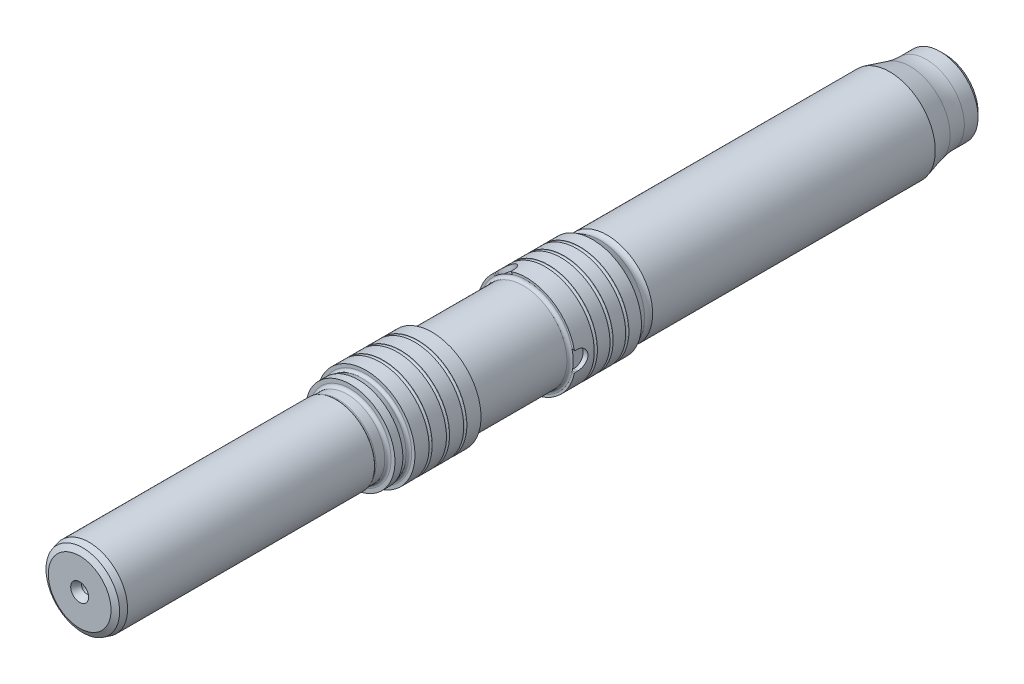
from build123d import *

# Parameters (mm, degrees)
CUT_EXTRUDE1_DEPTH = 1.55
CIRPATTERN1_COUNT  = 3


with BuildPart() as part:
    # Sketch1 → Revolve1 (revolve)
    with BuildSketch(Plane(origin=(0, 0, 0), x_dir=(0, 0, -1), z_dir=(1, 0, 0))):
        with BuildLine():
            Line((-17.5, 14.4875), (-107.351574436, 14.4875))
            ThreePointArc((-107.351574436, 14.4875), (-108.480333208, 13.985861828), (-109.688490196, 14.242949192))
            Line((-109.688490196, 14.242949192), (-112, 15.5775))
            Line((-112, 15.5775), (-116, 15.5775))
            Line((-116, 15.5775), (-116, 15.45))
            ThreePointArc((-116, 15.45), (-116.5, 14.95), (-117, 15.45))
            Line((-117, 15.45), (-117, 15.5775))
            Line((-117, 15.5775), (-121, 15.5775))
            Line((-121, 15.5775), (-121, 15.45))
            ThreePointArc((-121, 15.45), (-121.5, 14.95), (-122, 15.45))
            Line((-122, 15.45), (-122, 15.5775))
            Line((-122, 15.5775), (-126, 15.5775))
            Line((-126, 15.5775), (-126, 15.45))
            ThreePointArc((-126, 15.45), (-126.5, 14.95), (-127, 15.45))
            Line((-127, 15.45), (-127, 15.5775))
            Line((-127, 15.5775), (-133, 15.5775))
            Line((-133, 15.5775), (-133, 14.875))
            ThreePointArc((-133, 14.875), (-133.292893219, 14.167893219), (-134, 13.875))
            Line((-134, 13.875), (-162, 13.875))
            ThreePointArc((-162, 13.875), (-162.707106781, 14.167893219), (-163, 14.875))
            Line((-163, 14.875), (-163, 15.5775))
            Line((-163, 15.5775), (-167.5, 15.5775))
            Line((-167.5, 15.5775), (-167.5, 15.45))
            ThreePointArc((-167.5, 15.45), (-168, 14.95), (-168.5, 15.45))
            Line((-168.5, 15.45), (-168.5, 15.5775))
            Line((-168.5, 15.5775), (-173, 15.5775))
            Line((-173, 15.5775), (-173, 15.45))
            ThreePointArc((-173, 15.45), (-173.5, 14.95), (-174, 15.45))
            Line((-174, 15.45), (-174, 15.5775))
            Line((-174, 15.5775), (-178.5, 15.5775))
            Line((-178.5, 15.5775), (-178.5, 15.45))
            ThreePointArc((-178.5, 15.45), (-179, 14.95), (-179.5, 15.45))
            Line((-179.5, 15.45), (-179.5, 15.5775))
            Line((-179.5, 15.5775), (-184, 15.5775))
            Line((-184, 15.5775), (-184, 14.55))
            ThreePointArc((-184, 14.55), (-184.324003635, 13.907016749), (-185.033568652, 13.784855775))
            Line((-185.033568652, 13.784855775), (-186.5, 14.2325))
            Line((-186.5, 14.2325), (-189, 14.2325))
            Line((-189, 14.2325), (-189, 12.9925))
            ThreePointArc((-189, 12.9925), (-189.292893219, 12.285393219), (-190, 11.9925))
            Line((-190, 11.9925), (-192.84427521, 11.9925))
            ThreePointArc((-192.84427521, 11.9925), (-193.19427521, 12.0557503), (-193.5, 12.2375))
            Line((-193.5, 12.2375), (-272, 12.2375))
            Line((-272, 12.2375), (-274, 11.701601615))
            Line((-274, 11.701601615), (-275, 9.969550808))
            Line((-275, 9.969550808), (-275, 2.85))
            Line((-275, 2.85), (-272.79163522, 1.575))
            Line((-272.79163522, 1.575), (-269, 1.575))
            Line((-269, 1.575), (-268.053644525, 0))
            Line((-268.053644525, 0), (-6.946355475, 0))
            Line((-6.946355475, 0), (-6, 1.575))
            Line((-6, 1.575), (-2.20836478, 1.575))
            Line((-2.20836478, 1.575), (0, 2.85))
            Line((0, 2.85), (0, 10.575))
            Line((0, 10.575), (-1.5, 12.075))
            Line((-1.5, 12.075), (-5.863377475, 12.075))
            ThreePointArc((-5.863377475, 12.075), (-8.473901319, 12.246102773), (-11.039758377, 12.756483474))
            Line((-11.039758377, 12.756483474), (-17.5, 14.4875))
        make_face()
    revolve(axis=Axis((0, 0, 0), (0, 0, 1)))

    # Sketch3 → Cut-Extrude1 (cut)
    with BuildSketch(Plane(origin=(15.57875, 0, 0), x_dir=(0, 0, -1), z_dir=(1, 0, 0))):
        with BuildLine():
            Line((-132, 3), (-132.7, 3))
            ThreePointArc((-132.7, 3), (-132.912132034, 3.087867966), (-133, 3.3))
            Line((-133, 3.3), (-133, -3.3))
            ThreePointArc((-133, -3.3), (-132.912132034, -3.087867966), (-132.7, -3))
            Line((-132.7, -3), (-132, -3))
            ThreePointArc((-132, -3), (-129, 0), (-132, 3))
        make_face()
    cut_extrude1 = extrude(amount=-CUT_EXTRUDE1_DEPTH, mode=Mode.SUBTRACT)

    # CirPattern1: Cut-Extrude1 ×3 about axis
    cirpattern1_axis = Axis((0, 0, 0), (0, 0, 1))
    for i in range(1, CIRPATTERN1_COUNT):
        add(cut_extrude1.rotate(cirpattern1_axis, i * 360 / CIRPATTERN1_COUNT), mode=Mode.SUBTRACT)


solid = part.part
